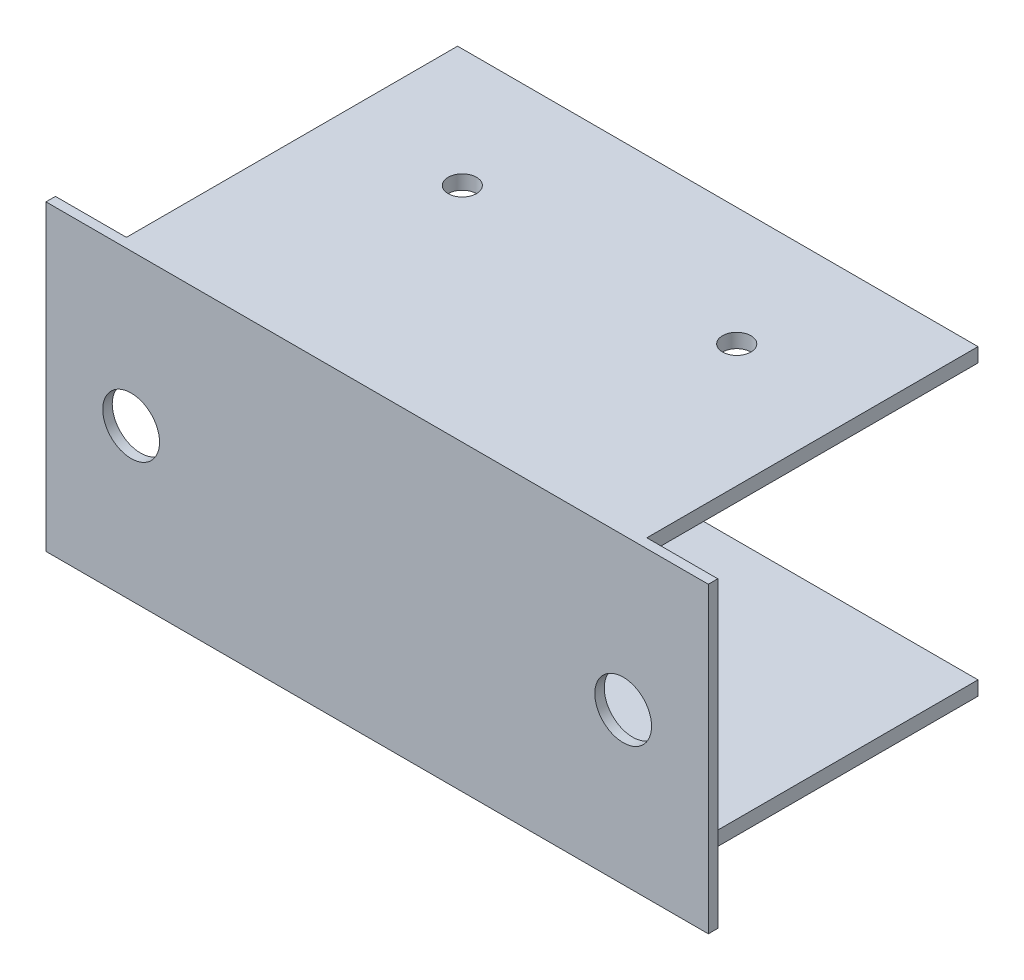
from build123d import *

# Parameters (mm, degrees)
SKETCH_1_W          = 70
SKETCH_1_H          = 32
EXTRUDE_1_DEPTH     = 1
SKETCH_2_R          = 3
CUT_EXTRUDE_1_DEPTH = 10
SKETCH_4_W          = 55
SKETCH_4_H          = 36
EXTRUDE_2_DEPTH     = 1.5
SKETCH_5_R          = 1.5
CUT_EXTRUDE_2_DEPTH = 59.940648113


with BuildPart() as part:
    # 草图1 → 凸台-拉伸1 (new body)
    with BuildSketch(Plane.XY):
        Rectangle(SKETCH_1_W, SKETCH_1_H)
    extrude(amount=EXTRUDE_1_DEPTH)

    # 草图2 → 切除-拉伸1 (cut)
    with BuildSketch(Plane.XY.offset(1)):
        with Locations((-26, 0)):
            Circle(SKETCH_2_R)
        with Locations((26, 0)):
            Circle(SKETCH_2_R)
    extrude(amount=-CUT_EXTRUDE_1_DEPTH, mode=Mode.SUBTRACT)

    # 草图4 → 凸台-拉伸2 (add)
    with BuildSketch(Plane(origin=(0, 16, 0), x_dir=(1, 0, 0), z_dir=(0, 1, 0))):
        with Locations((0, 17)):
            Rectangle(SKETCH_4_W, SKETCH_4_H)
    extrude_2 = extrude(amount=-EXTRUDE_2_DEPTH)

    # 草图5 → 切除-拉伸2 (cut, through all)
    with BuildSketch(Plane(origin=(0, 16, 0), x_dir=(1, 0, 0), z_dir=(0, 1, 0))):
        with Locations((-14.5, 22.5)):
            Circle(SKETCH_5_R)
        with Locations((14.5, 22.5)):
            Circle(SKETCH_5_R)
    extrude(amount=-CUT_EXTRUDE_2_DEPTH, mode=Mode.SUBTRACT)

    # 镜向1: 凸台-拉伸2 across plane
    add(extrude_2.mirror(Plane.ZX))


solid = part.part
